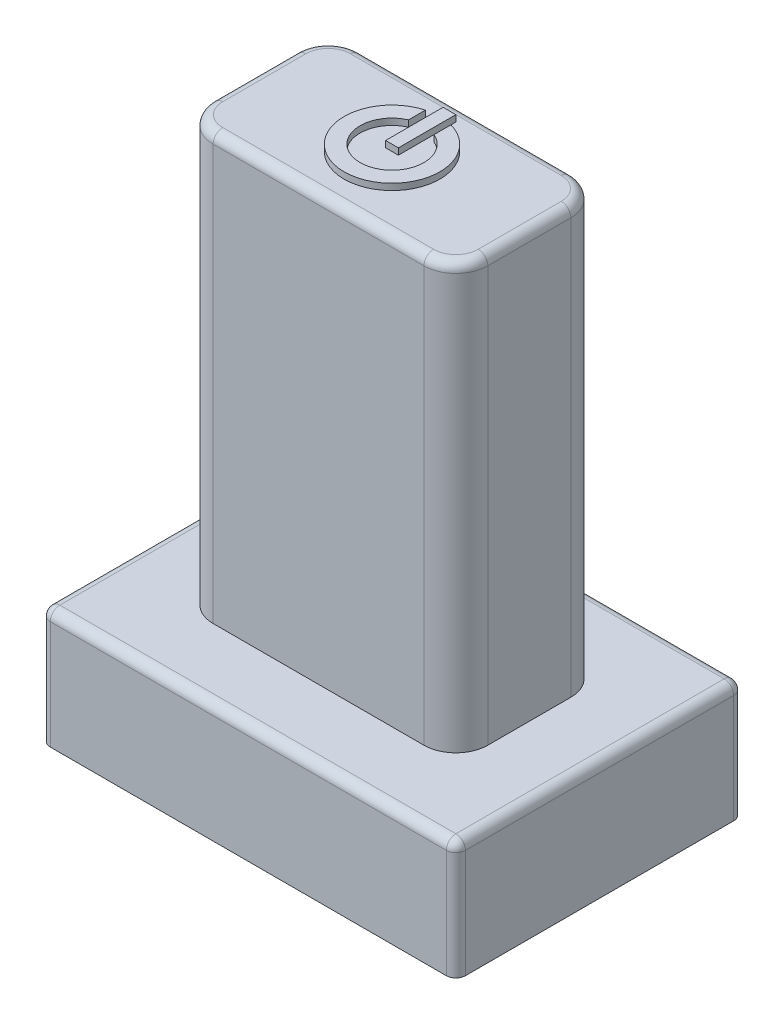
from build123d import *

# Parameters (mm, degrees)
SKETCH_1_W      = 8.6
SKETCH_1_H      = 4.6
EXTRUDE_1_DEPTH = 17
SKETCH_2_W      = 13
SKETCH_2_H      = 9
SKETCH_2_W_2    = 8.6
SKETCH_2_H_2    = 4.6
EXTRUDE_2_DEPTH = 3.7
FILLET_1_R      = 1
FILLET_2_R      = 0.3
EXTRUDE_3_DEPTH = 0.2


with BuildPart() as part:
    # 草图1 → 凸台-拉伸1 (new body)
    with BuildSketch(Plane(origin=(0, 0, 0), x_dir=(1, 0, 0), z_dir=(0, 1, 0))):
        with Locations((11.994336416, 2.5)):
            Rectangle(SKETCH_1_W, SKETCH_1_H)
    extrude(amount=EXTRUDE_1_DEPTH)

    # 草图2 → 凸台-拉伸2 (add)
    with BuildSketch(Plane.XZ):
        with Locations((11.994336416, -2.5)):
            Rectangle(SKETCH_2_W, SKETCH_2_H)
        with Locations((11.994336416, -2.5)):
            Rectangle(SKETCH_2_W_2, SKETCH_2_H_2, mode=Mode.SUBTRACT)
    extrude(amount=-EXTRUDE_2_DEPTH)

    # 圆角1
    fillet_1_edges = [part.edges().sort_by_distance(p)[0] for p in [
        (16.294336416, 10.35, -4.8),
        (16.294336416, 10.35, -0.2),
        (7.694336416, 10.35, -0.2),
        (7.694336416, 10.35, -4.8),
    ]]
    fillet(fillet_1_edges, radius=FILLET_1_R)

    # 圆角2
    fillet_2_edges = [part.edges().sort_by_distance(p)[0] for p in [
        (7.987229635, 17, -0.492893219),
        (7.694336416, 17, -2.5),
        (7.987229635, 17, -4.507106781),
        (11.994336416, 17, -4.8),
        (16.001443197, 17, -4.507106781),
        (16.294336416, 17, -2.5),
        (16.001443197, 17, -0.492893219),
        (11.994336416, 17, -0.2),
        (18.494336416, 1.85, 2),
        (5.494336416, 1.85, 2),
        (18.494336416, 1.85, -7),
        (5.494336416, 1.85, -7),
        (5.494336416, 3.7, -2.5),
        (11.994336416, 3.7, 2),
        (18.494336416, 3.7, -2.5),
        (11.994336416, 3.7, -7),
    ]]
    fillet(fillet_2_edges, radius=FILLET_2_R)

    # 草图3 → 凸台-拉伸3 (add)
    with BuildSketch(Plane(origin=(0, 17, 0), x_dir=(1, 0, 0), z_dir=(0, 1, 0))):
        Polygon((11.994336416, 2.5), (12.194336416, 2.5), (12.194336416, 4.3), (11.794336416, 4.3), (11.794336416, 2.5), align=None)
        with BuildLine():
            Line((11.594336416, 3.416515139), (11.594336416, 3.945683229))
            ThreePointArc((11.594336416, 3.945683229), (11.994336416, 1), (12.394336416, 3.945683229))
            Line((12.394336416, 3.945683229), (12.394336416, 3.416515139))
            ThreePointArc((12.394336416, 3.416515139), (11.994336416, 1.5), (11.594336416, 3.416515139))
        make_face()
    extrude(amount=EXTRUDE_3_DEPTH)


solid = part.part
